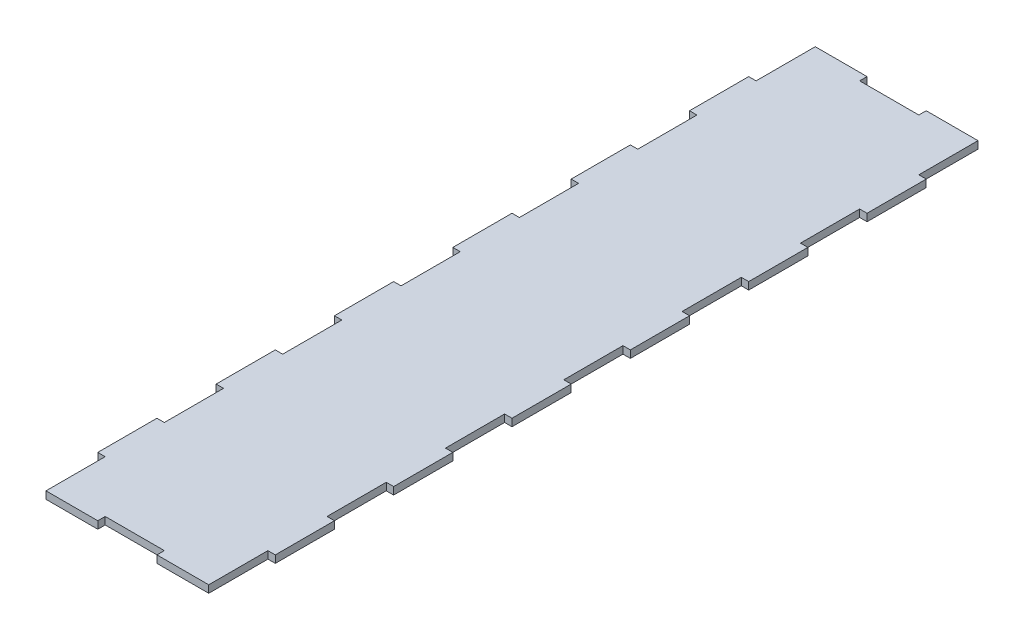
from build123d import *

# Parameters (mm, degrees)
BOSS_EXTRUDE1_DEPTH = 3.175
MIRROR1_START       = -161.925
MIRROR1_OUTLINE_W   = 69.85
MIRROR1_OUTLINE_H   = 3.175
MIRROR1_DEPTH       = 323.85
MIRROR1_START_2     = -165.1
MIRROR1_2_OUTLINE_W = 22.225
MIRROR1_2_OUTLINE_H = 3.175
MIRROR1_2_DEPTH     = 330.2
MIRROR1_START_3     = 12.7
MIRROR1_3_OUTLINE_W = 3.175
MIRROR1_3_OUTLINE_H = 3.175
MIRROR1_3_DEPTH     = 25.4
MIRROR1_START_4     = 63.5
MIRROR1_4_OUTLINE_W = 3.175
MIRROR1_4_OUTLINE_H = 3.175
MIRROR1_4_DEPTH     = 25.4
MIRROR1_START_5     = 114.3
MIRROR1_5_OUTLINE_W = 3.175
MIRROR1_5_OUTLINE_H = 3.175
MIRROR1_5_DEPTH     = 25.4
MIRROR1_START_6     = -139.7
MIRROR1_6_OUTLINE_W = 3.175
MIRROR1_6_OUTLINE_H = 3.175
MIRROR1_6_DEPTH     = 25.4
MIRROR1_START_7     = -88.9
MIRROR1_7_OUTLINE_W = 3.175
MIRROR1_7_OUTLINE_H = 3.175
MIRROR1_7_DEPTH     = 25.4
MIRROR1_START_8     = -38.1
MIRROR1_8_OUTLINE_W = 3.175
MIRROR1_8_OUTLINE_H = 3.175
MIRROR1_8_DEPTH     = 25.4


# Read off the part's stored shape, not the designer's step: Mirror1
with BuildPart() as part:
    # Sketch1 → Boss-Extrude1 (new body)
    with BuildSketch(Plane(origin=(0, 0, 0), x_dir=(1, 0, 0), z_dir=(0, 1, 0))):
        Polygon((0, 0), (0, 161.925), (-12.7, 161.925), (-12.7, 165.1), (-34.925, 165.1), (-34.925, 139.7), (-38.1, 139.7), (-38.1, 114.3), (-34.925, 114.3), (-34.925, 88.9), (-38.1, 88.9), (-38.1, 63.5), (-34.925, 63.5), (-34.925, 38.1), (-38.1, 38.1), (-38.1, 12.7), (-34.925, 12.7), (-34.925, 0), align=None)
    extrude(amount=BOSS_EXTRUDE1_DEPTH)

    # Mirror1 outline → Mirror1 (add)
    with BuildSketch(Plane.XY.offset(MIRROR1_START)):
        with Locations((0, 1.5875)):
            Rectangle(MIRROR1_OUTLINE_W, MIRROR1_OUTLINE_H)
    extrude(amount=MIRROR1_DEPTH)

    # Mirror1 2 outline → Mirror1 2 (add)
    with BuildSketch(Plane.XY.offset(MIRROR1_START_2)):
        with Locations((-23.8125, 1.5875)):
            Rectangle(MIRROR1_2_OUTLINE_W, MIRROR1_2_OUTLINE_H)
        with Locations((23.8125, 1.5875)):
            Rectangle(MIRROR1_2_OUTLINE_W, MIRROR1_2_OUTLINE_H)
    extrude(amount=MIRROR1_2_DEPTH)

    # Mirror1 3 outline → Mirror1 3 (add)
    with BuildSketch(Plane.XY.offset(MIRROR1_START_3)):
        with Locations((-36.5125, 1.5875)):
            Rectangle(MIRROR1_3_OUTLINE_W, MIRROR1_3_OUTLINE_H)
        with Locations((36.5125, 1.5875)):
            Rectangle(MIRROR1_3_OUTLINE_W, MIRROR1_3_OUTLINE_H)
    extrude(amount=MIRROR1_3_DEPTH)

    # Mirror1 4 outline → Mirror1 4 (add)
    with BuildSketch(Plane.XY.offset(MIRROR1_START_4)):
        with Locations((-36.5125, 1.5875)):
            Rectangle(MIRROR1_4_OUTLINE_W, MIRROR1_4_OUTLINE_H)
        with Locations((36.5125, 1.5875)):
            Rectangle(MIRROR1_4_OUTLINE_W, MIRROR1_4_OUTLINE_H)
    extrude(amount=MIRROR1_4_DEPTH)

    # Mirror1 5 outline → Mirror1 5 (add)
    with BuildSketch(Plane.XY.offset(MIRROR1_START_5)):
        with Locations((-36.5125, 1.5875)):
            Rectangle(MIRROR1_5_OUTLINE_W, MIRROR1_5_OUTLINE_H)
        with Locations((36.5125, 1.5875)):
            Rectangle(MIRROR1_5_OUTLINE_W, MIRROR1_5_OUTLINE_H)
    extrude(amount=MIRROR1_5_DEPTH)

    # Mirror1 6 outline → Mirror1 6 (add)
    with BuildSketch(Plane.XY.offset(MIRROR1_START_6)):
        with Locations((36.5125, 1.5875)):
            Rectangle(MIRROR1_6_OUTLINE_W, MIRROR1_6_OUTLINE_H)
    extrude(amount=MIRROR1_6_DEPTH)

    # Mirror1 7 outline → Mirror1 7 (add)
    with BuildSketch(Plane.XY.offset(MIRROR1_START_7)):
        with Locations((36.5125, 1.5875)):
            Rectangle(MIRROR1_7_OUTLINE_W, MIRROR1_7_OUTLINE_H)
    extrude(amount=MIRROR1_7_DEPTH)

    # Mirror1 8 outline → Mirror1 8 (add)
    with BuildSketch(Plane.XY.offset(MIRROR1_START_8)):
        with Locations((36.5125, 1.5875)):
            Rectangle(MIRROR1_8_OUTLINE_W, MIRROR1_8_OUTLINE_H)
    extrude(amount=MIRROR1_8_DEPTH)


solid = part.part
